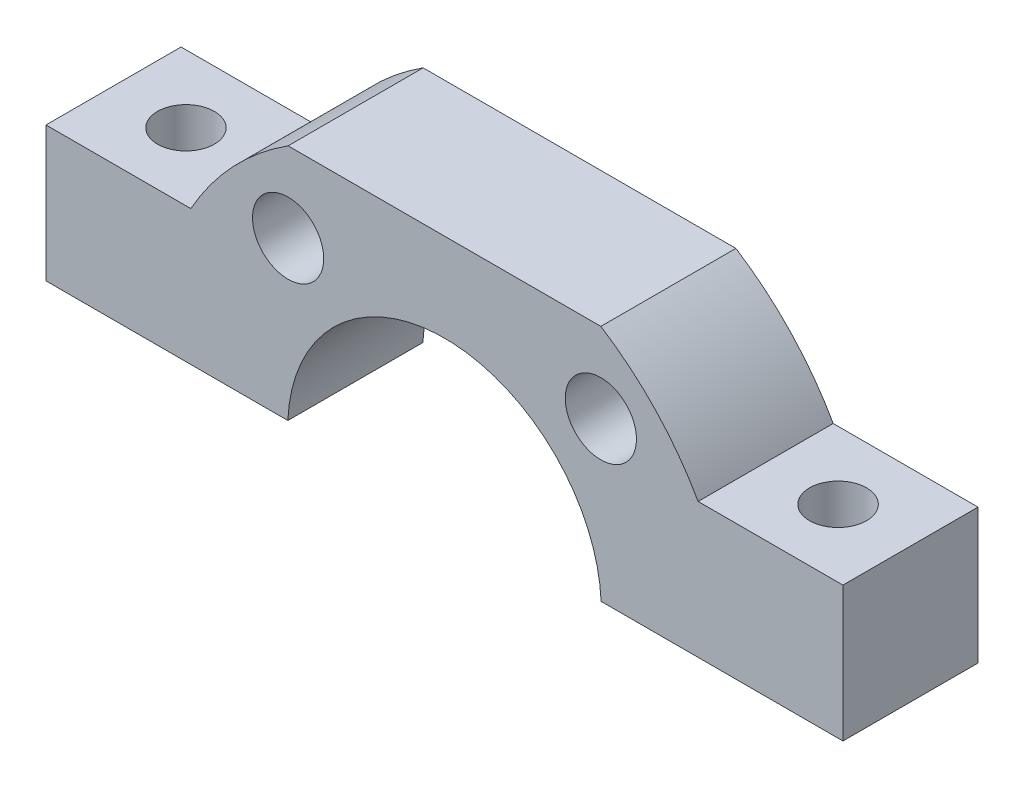
from build123d import *

# Parameters (mm, degrees)
SKETCH1_R           = 2.505
BOSS_EXTRUDE2_DEPTH = 9.5
CUT_EXTRUDE1_REACH  = 33.24
SKETCH2_R           = 2.005
SKETCH2_R_2         = 2
SKETCH3_W           = 72.995776
SKETCH3_H           = 18.148858384
CUT_EXTRUDE2_DEPTH  = 0.5


with BuildPart() as part:
    # Sketch1 → Boss-Extrude2 (new body)
    with BuildSketch(Plane.XY):
        with BuildLine():
            Line((-11.03, 0), (-28.03, 0))
            Line((-28.03, 0), (-28.03, 10))
            Line((-28.03, 10), (-17.842887818, 10))
            ThreePointArc((-17.842887818, 10), (-14.869374743, 14.045296026), (-11, 17.244380119))
            Line((-11, 17.244380119), (11, 17.244380119))
            ThreePointArc((11, 17.244380119), (14.869374743, 14.045296026), (17.842887818, 10))
            Line((17.842887818, 10), (28.03, 10))
            Line((28.03, 10), (28.03, 0))
            Line((28.03, 0), (11.03, 0))
            ThreePointArc((11.03, 0), (0, 11.03), (-11.03, 0))
        make_face()
        with Locations((11, 11.618950039)):
            Circle(SKETCH1_R, mode=Mode.SUBTRACT)
        with Locations((-11, 11.618950039)):
            Circle(SKETCH1_R, mode=Mode.SUBTRACT)
    extrude(amount=BOSS_EXTRUDE2_DEPTH)

    # Sketch2 → Cut-Extrude1 (cut, up to next)
    with BuildSketch(Plane(origin=(0, 10, 0), x_dir=(1, 0, 0), z_dir=(0, 1, 0)), mode=Mode.PRIVATE) as cut_extrude1_sk1:
        with Locations((22.936443909, -4.75)):
            Circle(SKETCH2_R)
    cut_extrude1_tool1 = extrude(cut_extrude1_sk1.sketch, amount=-CUT_EXTRUDE1_REACH, mode=Mode.PRIVATE) & part.part
    # Sketch2 → Cut-Extrude1 (cut, up to next)
    with BuildSketch(Plane(origin=(0, 10, 0), x_dir=(1, 0, 0), z_dir=(0, 1, 0)), mode=Mode.PRIVATE) as cut_extrude1_sk2:
        with Locations((-22.936443909, -4.75)):
            Circle(SKETCH2_R_2)
    cut_extrude1_tool2 = extrude(cut_extrude1_sk2.sketch, amount=-CUT_EXTRUDE1_REACH, mode=Mode.PRIVATE) & part.part
    add(cut_extrude1_tool1.solids().sort_by_distance((22.936444, 10, 4.75))[0], mode=Mode.SUBTRACT)
    add(cut_extrude1_tool2.solids().sort_by_distance((-22.936444, 10, 4.75))[0], mode=Mode.SUBTRACT)

    # Sketch3 → Cut-Extrude2 (cut)
    with BuildSketch(Plane.XZ):
        with Locations((1.301113009, 1.807163247)):
            Rectangle(SKETCH3_W, SKETCH3_H)
    extrude(amount=-CUT_EXTRUDE2_DEPTH, mode=Mode.SUBTRACT)


solid = part.part
